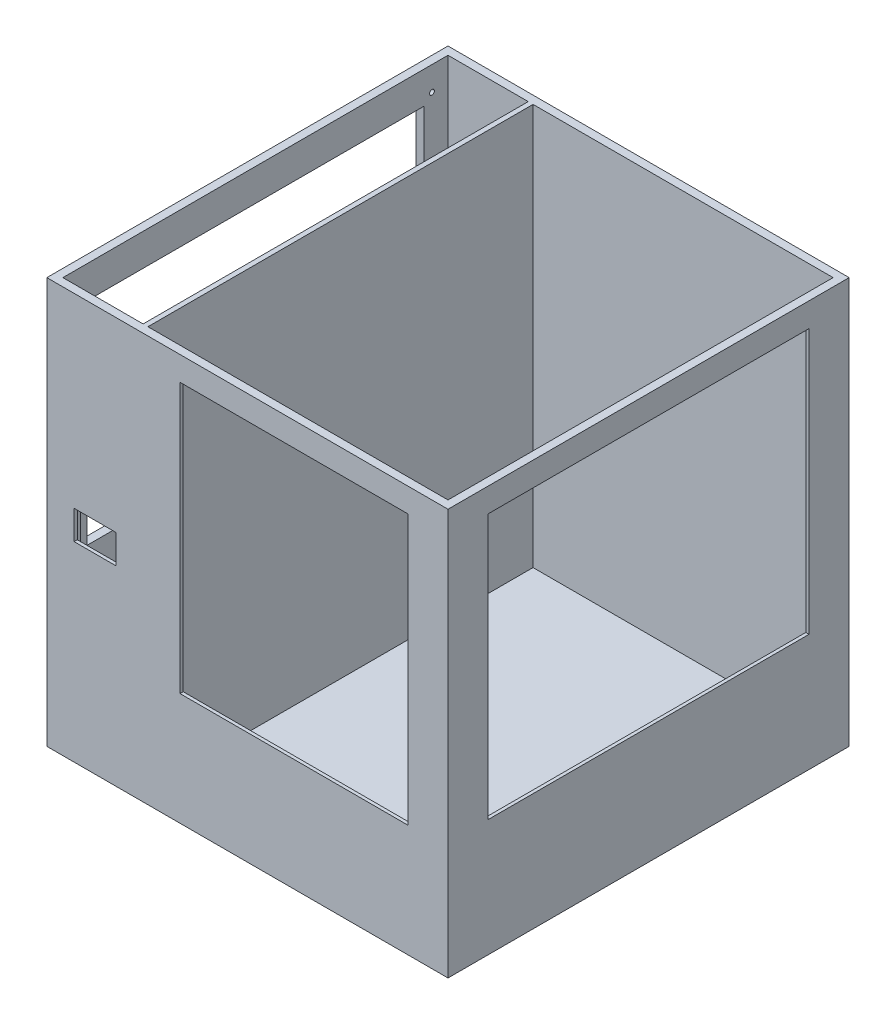
from build123d import *

# Parameters (mm, degrees)
SKETCH_1_W           = 250
SKETCH_1_H           = 250
EXTRUDE_1_DEPTH      = 3
SKETCH_2_W           = 250
SKETCH_2_H           = 250
SKETCH_2_W_2         = 240
SKETCH_2_H_2         = 240
EXTRUDE_2_DEPTH      = 250
SKETCH_3_W           = 3
SKETCH_3_H           = 240
EXTRUDE_3_DEPTH      = 250
SKETCH_8_W           = 200
SKETCH_8_H           = 165
CUT_EXTRUDE_4_DEPTH  = 8
SKETCH_9_W           = 220
SKETCH_9_H           = 185
CUT_EXTRUDE_5_DEPTH  = 3
SKETCH_11_W          = 142
SKETCH_11_H          = 168
CUT_EXTRUDE_6_DEPTH  = 10
SKETCH_12_W          = 162
SKETCH_12_H          = 188
CUT_EXTRUDE_7_DEPTH  = 3
SKETCH_16_W          = 26
SKETCH_16_H          = 18
CUT_EXTRUDE_10_DEPTH = 5
SKETCH_17_W          = 9
SKETCH_17_H          = 11
SKETCH_17_W_2        = 15
SKETCH_17_H_2        = 8
CUT_EXTRUDE_11_DEPTH = 10
SKETCH_21_W          = 28
SKETCH_21_H          = 28
CUT_EXTRUDE_14_DEPTH = 3
SKETCH_22_W          = 50
SKETCH_22_H          = 3
EXTRUDE_4_DEPTH      = 240
SKETCH_24_R          = 4
CUT_EXTRUDE_15_DEPTH = 10
SKETCH_25_W          = 210
SKETCH_25_H          = 132
CUT_EXTRUDE_16_DEPTH = 10
SKETCH_26_R          = 1.5
CUT_EXTRUDE_17_DEPTH = 10


with BuildPart() as part:
    # Эскиз1 → Бобышка-Вытянуть1 (new body)
    with BuildSketch(Plane(origin=(0, 0, 0), x_dir=(1, 0, 0), z_dir=(0, 1, 0))):
        Rectangle(SKETCH_1_W, SKETCH_1_H)
    extrude(amount=EXTRUDE_1_DEPTH)

    # Эскиз2 → Бобышка-Вытянуть2 (add)
    with BuildSketch(Plane(origin=(0, 3, 0), x_dir=(1, 0, 0), z_dir=(0, 1, 0))):
        Rectangle(SKETCH_2_W, SKETCH_2_H)
        Rectangle(SKETCH_2_W_2, SKETCH_2_H_2, mode=Mode.SUBTRACT)
    extrude(amount=EXTRUDE_2_DEPTH)

    # Эскиз3 → Бобышка-Вытянуть3 (add)
    with BuildSketch(Plane(origin=(0, 3, 0), x_dir=(1, 0, 0), z_dir=(0, 1, 0))):
        with Locations((-68.5, 0)):
            Rectangle(SKETCH_3_W, SKETCH_3_H)
    extrude(amount=EXTRUDE_3_DEPTH)

    # Эскиз8 → Вырез-Вытянуть4 (cut)
    with BuildSketch(Plane(origin=(125, 0, 0), x_dir=(0, 0, -1), z_dir=(1, 0, 0))):
        with Locations((0, 155.5)):
            Rectangle(SKETCH_8_W, SKETCH_8_H)
    extrude(amount=-CUT_EXTRUDE_4_DEPTH, mode=Mode.SUBTRACT)

    # Эскиз9 → Вырез-Вытянуть5 (cut)
    with BuildSketch(Plane.ZY.offset(-120)):
        with Locations((0, 155.5)):
            Rectangle(SKETCH_9_W, SKETCH_9_H)
    extrude(amount=-CUT_EXTRUDE_5_DEPTH, mode=Mode.SUBTRACT)

    # Эскиз11 → Вырез-Вытянуть6 (cut)
    with BuildSketch(Plane.XY.offset(125)):
        with Locations((29, 154)):
            Rectangle(SKETCH_11_W, SKETCH_11_H)
    extrude(amount=-CUT_EXTRUDE_6_DEPTH, mode=Mode.SUBTRACT)

    # Эскиз12 → Вырез-Вытянуть7 (cut)
    with BuildSketch(Plane(origin=(0, 0, 120), x_dir=(-1, 0, 0), z_dir=(0, 0, -1))):
        with Locations((-29, 154)):
            Rectangle(SKETCH_12_W, SKETCH_12_H)
    extrude(amount=-CUT_EXTRUDE_7_DEPTH, mode=Mode.SUBTRACT)

    # Эскиз16 → Вырез-Вытянуть10 (cut)
    with BuildSketch(Plane.XY.offset(125)):
        with Locations((-95, 128)):
            Rectangle(SKETCH_16_W, SKETCH_16_H)
    extrude(amount=-CUT_EXTRUDE_10_DEPTH, mode=Mode.SUBTRACT)

    # Эскиз17 → Вырез-Вытянуть11 (cut)
    with BuildSketch(Plane.ZY.offset(125)):
        with Locations((105.5, 80.5)):
            Rectangle(SKETCH_17_W, SKETCH_17_H)
        with Locations((73.5, 79)):
            Rectangle(SKETCH_17_W_2, SKETCH_17_H_2)
    extrude(amount=-CUT_EXTRUDE_11_DEPTH, mode=Mode.SUBTRACT)

    # Эскиз21 → Вырез-Вытянуть14 (cut)
    with BuildSketch(Plane(origin=(0, 0, 120), x_dir=(-1, 0, 0), z_dir=(0, 0, -1))):
        with Locations((95, 128)):
            Rectangle(SKETCH_21_W, SKETCH_21_H)
    extrude(amount=-CUT_EXTRUDE_14_DEPTH, mode=Mode.SUBTRACT)

    # Эскиз22 → Бобышка-Вытянуть4 (add)
    with BuildSketch(Plane.XY.offset(-120)):
        with Locations((-95, 71.5)):
            Rectangle(SKETCH_22_W, SKETCH_22_H)
    extrude(amount=EXTRUDE_4_DEPTH)

    # Эскиз24 → Вырез-Вытянуть15 (cut)
    with BuildSketch(Plane(origin=(-67, 0, 0), x_dir=(0, 0, -1), z_dir=(1, 0, 0))):
        with Locations((86.5, 53)):
            Circle(SKETCH_24_R)
    extrude(amount=-CUT_EXTRUDE_15_DEPTH, mode=Mode.SUBTRACT)

    # Эскиз25 → Вырез-Вытянуть16 (cut)
    with BuildSketch(Plane.ZY.offset(125)):
        with Locations((0, 167)):
            Rectangle(SKETCH_25_W, SKETCH_25_H)
    extrude(amount=-CUT_EXTRUDE_16_DEPTH, mode=Mode.SUBTRACT)

    # Эскиз26 → Вырез-Вытянуть17 (cut)
    with BuildSketch(Plane.ZY.offset(125)):
        with Locations((-110, 238)):
            Circle(SKETCH_26_R)
        with Locations((110, 238)):
            Circle(SKETCH_26_R)
        with Locations((110, 96)):
            Circle(SKETCH_26_R)
        with Locations((-110, 96)):
            Circle(SKETCH_26_R)
    extrude(amount=-CUT_EXTRUDE_17_DEPTH, mode=Mode.SUBTRACT)


solid = part.part
